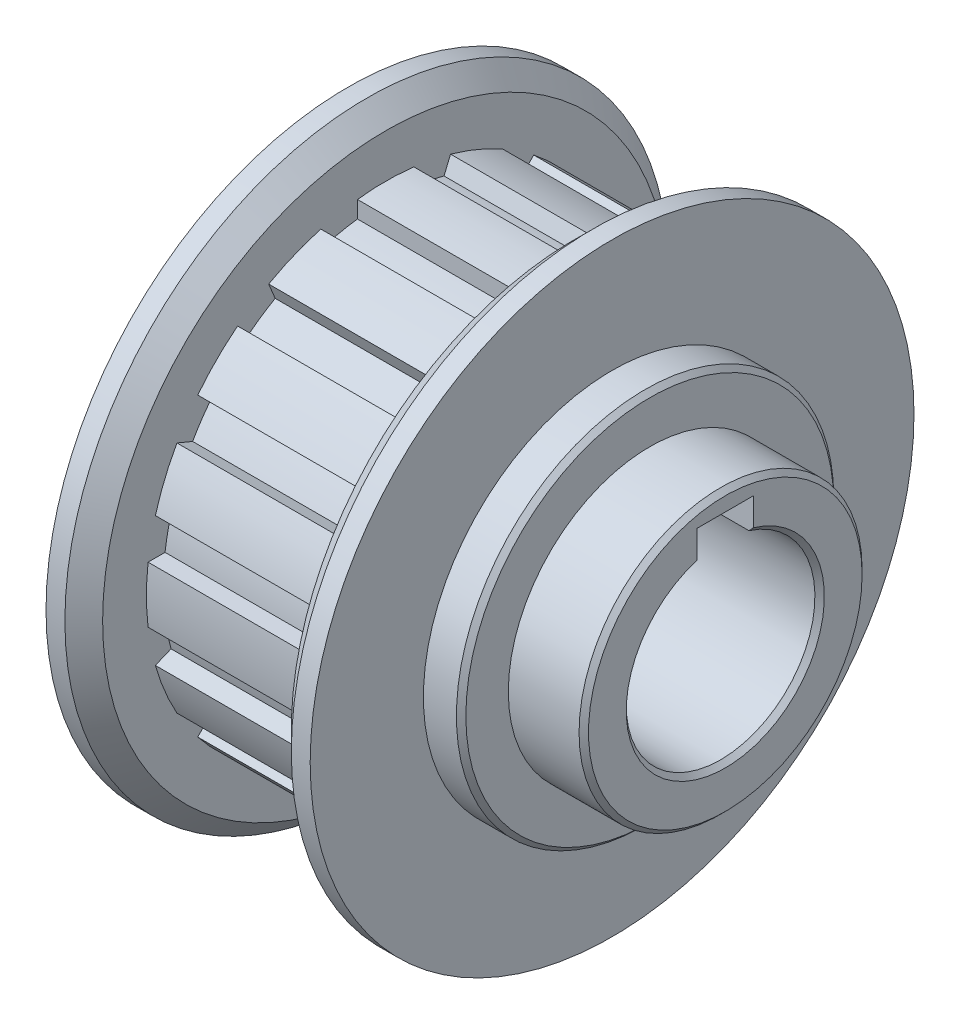
from build123d import *

# Parameters (mm, degrees)
BOSS_EXTRUDE1_START       = -13
BOSS_EXTRUDE1_DEPTH       = 14
BOSS_EXTRUDE1_START_2     = -25
BOSS_EXTRUDE1_2_OUTLINE_R = 9
BOSS_EXTRUDE1_2_DEPTH     = 12
BOSS_EXTRUDE1_START_3     = -1
BOSS_EXTRUDE1_3_OUTLINE_R = 16
BOSS_EXTRUDE1_3_DEPTH     = 2
BOSS_EXTRUDE1_4_OUTLINE_R = 14.25
BOSS_EXTRUDE1_4_DEPTH     = 0.9999999
SKETCH5_R                 = 16
BOSS_EXTRUDE3_DEPTH       = 2
SKETCH6_R                 = 10
BOSS_EXTRUDE4_DEPTH       = 12
CHAMFER1_SIZE             = 1
CUT_EXTRUDE1_START        = -10
SKETCH2_R                 = 10
SKETCH2_R_2               = 7.5
CUT_EXTRUDE1_DEPTH        = 10
CUT_EXTRUDE2_DEPTH        = 28.712812921
CUT_EXTRUDE2_DEPTH_BACK   = 28.712812921
SKETCH4_R                 = 5
CUT_EXTRUDE3_START        = -6
SKETCH7_R                 = 7.5
CUT_EXTRUDE3_DEPTH        = 6
CHAMFER2_SIZE             = 0.25
SKETCH8_W                 = 3
SKETCH8_H                 = 3
CUT_EXTRUDE4_DEPTH        = 31.199337741


with BuildPart() as part:
    # Boss-Extrude1: read off the stored shape, not the designer's step
    # Boss-Extrude1 outline → Boss-Extrude1 (new body)
    with BuildSketch(Plane.ZY.offset(BOSS_EXTRUDE1_START)):
        with BuildLine():
            ThreePointArc((-1.493827307, 11.692460658), (-2.299627171, 11.561006493), (-3.094394503, 11.374088047))
            Line((-3.094394503, 11.374088047), (-3.438518062, 12.20487581))
            ThreePointArc((-3.438518062, 12.20487581), (-4.852425922, 11.714792472), (-6.19875101, 11.061549888))
            Line((-6.19875101, 11.061549888), (-5.854627451, 10.230762125))
            ThreePointArc((-5.854627451, 10.230762125), (-6.548784122, 9.800948055), (-7.211522801, 9.324113638))
            Line((-7.211522801, 9.324113638), (-7.847380226, 9.959971063))
            ThreePointArc((-7.847380226, 9.959971063), (-8.966113985, 8.966113985), (-9.959971063, 7.847380226))
            Line((-9.959971063, 7.847380226), (-9.324113638, 7.211522801))
            ThreePointArc((-9.324113638, 7.211522801), (-9.800948055, 6.548784122), (-10.230762125, 5.854627451))
            Line((-10.230762125, 5.854627451), (-11.061549888, 6.19875101))
            ThreePointArc((-11.061549888, 6.19875101), (-11.714792472, 4.852425922), (-12.20487581, 3.438518062))
            Line((-12.20487581, 3.438518062), (-11.374088047, 3.094394503))
            ThreePointArc((-11.374088047, 3.094394503), (-11.561006493, 2.299627171), (-11.692460658, 1.493827307))
            Line((-11.692460658, 1.493827307), (-12.591698852, 1.493827307))
            ThreePointArc((-12.591698852, 1.493827307), (-12.68, 0), (-12.591698852, -1.493827307))
            Line((-12.591698852, -1.493827307), (-11.692460658, -1.493827307))
            ThreePointArc((-11.692460658, -1.493827307), (-11.561006493, -2.299627171), (-11.374088047, -3.094394503))
            Line((-11.374088047, -3.094394503), (-12.20487581, -3.438518062))
            ThreePointArc((-12.20487581, -3.438518062), (-11.714792472, -4.852425922), (-11.061549888, -6.19875101))
            Line((-11.061549888, -6.19875101), (-10.230762125, -5.854627451))
            ThreePointArc((-10.230762125, -5.854627451), (-9.800948055, -6.548784122), (-9.324113638, -7.211522801))
            Line((-9.324113638, -7.211522801), (-9.959971063, -7.847380226))
            ThreePointArc((-9.959971063, -7.847380226), (-8.966113985, -8.966113985), (-7.847380226, -9.959971063))
            Line((-7.847380226, -9.959971063), (-7.211522801, -9.324113638))
            ThreePointArc((-7.211522801, -9.324113638), (-6.548784122, -9.800948055), (-5.854627451, -10.230762125))
            Line((-5.854627451, -10.230762125), (-6.19875101, -11.061549888))
            ThreePointArc((-6.19875101, -11.061549888), (-4.852425922, -11.714792472), (-3.438518062, -12.20487581))
            Line((-3.438518062, -12.20487581), (-3.094394503, -11.374088047))
            ThreePointArc((-3.094394503, -11.374088047), (-2.299627171, -11.561006493), (-1.493827307, -11.692460658))
            Line((-1.493827307, -11.692460658), (-1.493827307, -12.591698852))
            ThreePointArc((-1.493827307, -12.591698852), (0, -12.68), (1.493827307, -12.591698852))
            Line((1.493827307, -12.591698852), (1.493827307, -11.692460658))
            ThreePointArc((1.493827307, -11.692460658), (2.299627171, -11.561006493), (3.094394503, -11.374088047))
            Line((3.094394503, -11.374088047), (3.438518062, -12.20487581))
            ThreePointArc((3.438518062, -12.20487581), (4.852425922, -11.714792472), (6.19875101, -11.061549888))
            Line((6.19875101, -11.061549888), (5.854627451, -10.230762125))
            ThreePointArc((5.854627451, -10.230762125), (6.548784122, -9.800948055), (7.211522801, -9.324113638))
            Line((7.211522801, -9.324113638), (7.847380226, -9.959971063))
            ThreePointArc((7.847380226, -9.959971063), (8.966113985, -8.966113985), (9.959971063, -7.847380226))
            Line((9.959971063, -7.847380226), (9.324113638, -7.211522801))
            ThreePointArc((9.324113638, -7.211522801), (9.800948055, -6.548784122), (10.230762125, -5.854627451))
            Line((10.230762125, -5.854627451), (11.061549888, -6.19875101))
            ThreePointArc((11.061549888, -6.19875101), (11.714792472, -4.852425922), (12.20487581, -3.438518062))
            Line((12.20487581, -3.438518062), (11.374088047, -3.094394503))
            ThreePointArc((11.374088047, -3.094394503), (11.561006493, -2.299627171), (11.692460658, -1.493827307))
            Line((11.692460658, -1.493827307), (12.591698852, -1.493827307))
            ThreePointArc((12.591698852, -1.493827307), (12.68, 0), (12.591698852, 1.493827307))
            Line((12.591698852, 1.493827307), (11.692460658, 1.493827307))
            ThreePointArc((11.692460658, 1.493827307), (11.561006493, 2.299627171), (11.374088047, 3.094394503))
            Line((11.374088047, 3.094394503), (12.20487581, 3.438518062))
            ThreePointArc((12.20487581, 3.438518062), (11.714792472, 4.852425922), (11.061549888, 6.19875101))
            Line((11.061549888, 6.19875101), (10.230762125, 5.854627451))
            ThreePointArc((10.230762125, 5.854627451), (9.800948055, 6.548784122), (9.324113638, 7.211522801))
            Line((9.324113638, 7.211522801), (9.959971063, 7.847380226))
            ThreePointArc((9.959971063, 7.847380226), (8.966113985, 8.966113985), (7.847380226, 9.959971063))
            Line((7.847380226, 9.959971063), (7.211522801, 9.324113638))
            ThreePointArc((7.211522801, 9.324113638), (6.548784122, 9.800948055), (5.854627451, 10.230762125))
            Line((5.854627451, 10.230762125), (6.19875101, 11.061549888))
            ThreePointArc((6.19875101, 11.061549888), (4.852425922, 11.714792472), (3.438518062, 12.20487581))
            Line((3.438518062, 12.20487581), (3.094394503, 11.374088047))
            ThreePointArc((3.094394503, 11.374088047), (2.299627171, 11.561006493), (1.493827307, 11.692460658))
            Line((1.493827307, 11.692460658), (1.493827307, 12.591698852))
            ThreePointArc((1.493827307, 12.591698852), (0, 12.68), (-1.493827307, 12.591698852))
            Line((-1.493827307, 12.591698852), (-1.493827307, 11.692460658))
        make_face()
    extrude(amount=BOSS_EXTRUDE1_DEPTH)

    # Boss-Extrude1 2 outline → Boss-Extrude1 2 (add)
    with BuildSketch(Plane.ZY.offset(BOSS_EXTRUDE1_START_2)):
        Circle(BOSS_EXTRUDE1_2_OUTLINE_R)
    extrude(amount=BOSS_EXTRUDE1_2_DEPTH)

    # Boss-Extrude1 3 outline → Boss-Extrude1 3 (add)
    with BuildSketch(Plane.ZY.offset(BOSS_EXTRUDE1_START_3)):
        Circle(BOSS_EXTRUDE1_3_OUTLINE_R)
        with BuildLine():
            Line((-3.438518062, 12.20487581), (-3.094394503, 11.374088047))
            ThreePointArc((-3.094394503, 11.374088047), (-2.299627171, 11.561006493), (-1.493827307, 11.692460658))
            Line((-1.493827307, 11.692460658), (-1.493827307, 12.591698852))
            ThreePointArc((-1.493827307, 12.591698852), (0, 12.68), (1.493827307, 12.591698852))
            Line((1.493827307, 12.591698852), (1.493827307, 11.692460658))
            ThreePointArc((1.493827307, 11.692460658), (2.299627171, 11.561006493), (3.094394503, 11.374088047))
            Line((3.094394503, 11.374088047), (3.438518062, 12.20487581))
            ThreePointArc((3.438518062, 12.20487581), (4.852425922, 11.714792472), (6.19875101, 11.061549888))
            Line((6.19875101, 11.061549888), (5.854627451, 10.230762125))
            ThreePointArc((5.854627451, 10.230762125), (6.548784122, 9.800948055), (7.211522801, 9.324113638))
            Line((7.211522801, 9.324113638), (7.847380226, 9.959971063))
            ThreePointArc((7.847380226, 9.959971063), (8.966113985, 8.966113985), (9.959971063, 7.847380226))
            Line((9.959971063, 7.847380226), (9.324113638, 7.211522801))
            ThreePointArc((9.324113638, 7.211522801), (9.800948055, 6.548784122), (10.230762125, 5.854627451))
            Line((10.230762125, 5.854627451), (11.061549888, 6.19875101))
            ThreePointArc((11.061549888, 6.19875101), (11.714792472, 4.852425922), (12.20487581, 3.438518062))
            Line((12.20487581, 3.438518062), (11.374088047, 3.094394503))
            ThreePointArc((11.374088047, 3.094394503), (11.561006493, 2.299627171), (11.692460658, 1.493827307))
            Line((11.692460658, 1.493827307), (12.591698852, 1.493827307))
            ThreePointArc((12.591698852, 1.493827307), (12.68, 0), (12.591698852, -1.493827307))
            Line((12.591698852, -1.493827307), (11.692460658, -1.493827307))
            ThreePointArc((11.692460658, -1.493827307), (11.561006493, -2.299627171), (11.374088047, -3.094394503))
            Line((11.374088047, -3.094394503), (12.20487581, -3.438518062))
            ThreePointArc((12.20487581, -3.438518062), (11.714792472, -4.852425922), (11.061549888, -6.19875101))
            Line((11.061549888, -6.19875101), (10.230762125, -5.854627451))
            ThreePointArc((10.230762125, -5.854627451), (9.800948055, -6.548784122), (9.324113638, -7.211522801))
            Line((9.324113638, -7.211522801), (9.959971063, -7.847380226))
            ThreePointArc((9.959971063, -7.847380226), (8.966113985, -8.966113985), (7.847380226, -9.959971063))
            Line((7.847380226, -9.959971063), (7.211522801, -9.324113638))
            ThreePointArc((7.211522801, -9.324113638), (6.548784122, -9.800948055), (5.854627451, -10.230762125))
            Line((5.854627451, -10.230762125), (6.19875101, -11.061549888))
            ThreePointArc((6.19875101, -11.061549888), (4.852425922, -11.714792472), (3.438518062, -12.20487581))
            Line((3.438518062, -12.20487581), (3.094394503, -11.374088047))
            ThreePointArc((3.094394503, -11.374088047), (2.299627171, -11.561006493), (1.493827307, -11.692460658))
            Line((1.493827307, -11.692460658), (1.493827307, -12.591698852))
            ThreePointArc((1.493827307, -12.591698852), (0, -12.68), (-1.493827307, -12.591698852))
            Line((-1.493827307, -12.591698852), (-1.493827307, -11.692460658))
            ThreePointArc((-1.493827307, -11.692460658), (-2.299627171, -11.561006493), (-3.094394503, -11.374088047))
            Line((-3.094394503, -11.374088047), (-3.438518062, -12.20487581))
            ThreePointArc((-3.438518062, -12.20487581), (-4.852425922, -11.714792472), (-6.19875101, -11.061549888))
            Line((-6.19875101, -11.061549888), (-5.854627451, -10.230762125))
            ThreePointArc((-5.854627451, -10.230762125), (-6.548784122, -9.800948055), (-7.211522801, -9.324113638))
            Line((-7.211522801, -9.324113638), (-7.847380226, -9.959971063))
            ThreePointArc((-7.847380226, -9.959971063), (-8.966113985, -8.966113985), (-9.959971063, -7.847380226))
            Line((-9.959971063, -7.847380226), (-9.324113638, -7.211522801))
            ThreePointArc((-9.324113638, -7.211522801), (-9.800948055, -6.548784122), (-10.230762125, -5.854627451))
            Line((-10.230762125, -5.854627451), (-11.061549888, -6.19875101))
            ThreePointArc((-11.061549888, -6.19875101), (-11.714792472, -4.852425922), (-12.20487581, -3.438518062))
            Line((-12.20487581, -3.438518062), (-11.374088047, -3.094394503))
            ThreePointArc((-11.374088047, -3.094394503), (-11.561006493, -2.299627171), (-11.692460658, -1.493827307))
            Line((-11.692460658, -1.493827307), (-12.591698852, -1.493827307))
            ThreePointArc((-12.591698852, -1.493827307), (-12.68, 0), (-12.591698852, 1.493827307))
            Line((-12.591698852, 1.493827307), (-11.692460658, 1.493827307))
            ThreePointArc((-11.692460658, 1.493827307), (-11.561006493, 2.299627171), (-11.374088047, 3.094394503))
            Line((-11.374088047, 3.094394503), (-12.20487581, 3.438518062))
            ThreePointArc((-12.20487581, 3.438518062), (-11.714792472, 4.852425922), (-11.061549888, 6.19875101))
            Line((-11.061549888, 6.19875101), (-10.230762125, 5.854627451))
            ThreePointArc((-10.230762125, 5.854627451), (-9.800948055, 6.548784122), (-9.324113638, 7.211522801))
            Line((-9.324113638, 7.211522801), (-9.959971063, 7.847380226))
            ThreePointArc((-9.959971063, 7.847380226), (-8.966113985, 8.966113985), (-7.847380226, 9.959971063))
            Line((-7.847380226, 9.959971063), (-7.211522801, 9.324113638))
            ThreePointArc((-7.211522801, 9.324113638), (-6.548784122, 9.800948055), (-5.854627451, 10.230762125))
            Line((-5.854627451, 10.230762125), (-6.19875101, 11.061549888))
            ThreePointArc((-6.19875101, 11.061549888), (-4.852425922, 11.714792472), (-3.438518062, 12.20487581))
        make_face(mode=Mode.SUBTRACT)
    extrude(amount=BOSS_EXTRUDE1_3_DEPTH)

    # Boss-Extrude1 4 outline → Boss-Extrude1 4 (add)
    with BuildSketch(Plane.ZY.offset(BOSS_EXTRUDE1_START)):
        Circle(BOSS_EXTRUDE1_4_OUTLINE_R)
        with BuildLine():
            Line((-3.438518062, 12.20487581), (-3.094394503, 11.374088047))
            ThreePointArc((-3.094394503, 11.374088047), (-2.299627171, 11.561006493), (-1.493827307, 11.692460658))
            Line((-1.493827307, 11.692460658), (-1.493827307, 12.591698852))
            ThreePointArc((-1.493827307, 12.591698852), (0, 12.68), (1.493827307, 12.591698852))
            Line((1.493827307, 12.591698852), (1.493827307, 11.692460658))
            ThreePointArc((1.493827307, 11.692460658), (2.299627171, 11.561006493), (3.094394503, 11.374088047))
            Line((3.094394503, 11.374088047), (3.438518062, 12.20487581))
            ThreePointArc((3.438518062, 12.20487581), (4.852425922, 11.714792472), (6.19875101, 11.061549888))
            Line((6.19875101, 11.061549888), (5.854627451, 10.230762125))
            ThreePointArc((5.854627451, 10.230762125), (6.548784122, 9.800948055), (7.211522801, 9.324113638))
            Line((7.211522801, 9.324113638), (7.847380226, 9.959971063))
            ThreePointArc((7.847380226, 9.959971063), (8.966113985, 8.966113985), (9.959971063, 7.847380226))
            Line((9.959971063, 7.847380226), (9.324113638, 7.211522801))
            ThreePointArc((9.324113638, 7.211522801), (9.800948055, 6.548784122), (10.230762125, 5.854627451))
            Line((10.230762125, 5.854627451), (11.061549888, 6.19875101))
            ThreePointArc((11.061549888, 6.19875101), (11.714792472, 4.852425922), (12.20487581, 3.438518062))
            Line((12.20487581, 3.438518062), (11.374088047, 3.094394503))
            ThreePointArc((11.374088047, 3.094394503), (11.561006493, 2.299627171), (11.692460658, 1.493827307))
            Line((11.692460658, 1.493827307), (12.591698852, 1.493827307))
            ThreePointArc((12.591698852, 1.493827307), (12.68, 0), (12.591698852, -1.493827307))
            Line((12.591698852, -1.493827307), (11.692460658, -1.493827307))
            ThreePointArc((11.692460658, -1.493827307), (11.561006493, -2.299627171), (11.374088047, -3.094394503))
            Line((11.374088047, -3.094394503), (12.20487581, -3.438518062))
            ThreePointArc((12.20487581, -3.438518062), (11.714792472, -4.852425922), (11.061549888, -6.19875101))
            Line((11.061549888, -6.19875101), (10.230762125, -5.854627451))
            ThreePointArc((10.230762125, -5.854627451), (9.800948055, -6.548784122), (9.324113638, -7.211522801))
            Line((9.324113638, -7.211522801), (9.959971063, -7.847380226))
            ThreePointArc((9.959971063, -7.847380226), (8.966113985, -8.966113985), (7.847380226, -9.959971063))
            Line((7.847380226, -9.959971063), (7.211522801, -9.324113638))
            ThreePointArc((7.211522801, -9.324113638), (6.548784122, -9.800948055), (5.854627451, -10.230762125))
            Line((5.854627451, -10.230762125), (6.19875101, -11.061549888))
            ThreePointArc((6.19875101, -11.061549888), (4.852425922, -11.714792472), (3.438518062, -12.20487581))
            Line((3.438518062, -12.20487581), (3.094394503, -11.374088047))
            ThreePointArc((3.094394503, -11.374088047), (2.299627171, -11.561006493), (1.493827307, -11.692460658))
            Line((1.493827307, -11.692460658), (1.493827307, -12.591698852))
            ThreePointArc((1.493827307, -12.591698852), (0, -12.68), (-1.493827307, -12.591698852))
            Line((-1.493827307, -12.591698852), (-1.493827307, -11.692460658))
            ThreePointArc((-1.493827307, -11.692460658), (-2.299627171, -11.561006493), (-3.094394503, -11.374088047))
            Line((-3.094394503, -11.374088047), (-3.438518062, -12.20487581))
            ThreePointArc((-3.438518062, -12.20487581), (-4.852425922, -11.714792472), (-6.19875101, -11.061549888))
            Line((-6.19875101, -11.061549888), (-5.854627451, -10.230762125))
            ThreePointArc((-5.854627451, -10.230762125), (-6.548784122, -9.800948055), (-7.211522801, -9.324113638))
            Line((-7.211522801, -9.324113638), (-7.847380226, -9.959971063))
            ThreePointArc((-7.847380226, -9.959971063), (-8.966113985, -8.966113985), (-9.959971063, -7.847380226))
            Line((-9.959971063, -7.847380226), (-9.324113638, -7.211522801))
            ThreePointArc((-9.324113638, -7.211522801), (-9.800948055, -6.548784122), (-10.230762125, -5.854627451))
            Line((-10.230762125, -5.854627451), (-11.061549888, -6.19875101))
            ThreePointArc((-11.061549888, -6.19875101), (-11.714792472, -4.852425922), (-12.20487581, -3.438518062))
            Line((-12.20487581, -3.438518062), (-11.374088047, -3.094394503))
            ThreePointArc((-11.374088047, -3.094394503), (-11.561006493, -2.299627171), (-11.692460658, -1.493827307))
            Line((-11.692460658, -1.493827307), (-12.591698852, -1.493827307))
            ThreePointArc((-12.591698852, -1.493827307), (-12.68, 0), (-12.591698852, 1.493827307))
            Line((-12.591698852, 1.493827307), (-11.692460658, 1.493827307))
            ThreePointArc((-11.692460658, 1.493827307), (-11.561006493, 2.299627171), (-11.374088047, 3.094394503))
            Line((-11.374088047, 3.094394503), (-12.20487581, 3.438518062))
            ThreePointArc((-12.20487581, 3.438518062), (-11.714792472, 4.852425922), (-11.061549888, 6.19875101))
            Line((-11.061549888, 6.19875101), (-10.230762125, 5.854627451))
            ThreePointArc((-10.230762125, 5.854627451), (-9.800948055, 6.548784122), (-9.324113638, 7.211522801))
            Line((-9.324113638, 7.211522801), (-9.959971063, 7.847380226))
            ThreePointArc((-9.959971063, 7.847380226), (-8.966113985, 8.966113985), (-7.847380226, 9.959971063))
            Line((-7.847380226, 9.959971063), (-7.211522801, 9.324113638))
            ThreePointArc((-7.211522801, 9.324113638), (-6.548784122, 9.800948055), (-5.854627451, 10.230762125))
            Line((-5.854627451, 10.230762125), (-6.19875101, 11.061549888))
            ThreePointArc((-6.19875101, 11.061549888), (-4.852425922, 11.714792472), (-3.438518062, 12.20487581))
        make_face(mode=Mode.SUBTRACT)
    extrude(amount=BOSS_EXTRUDE1_4_DEPTH)

    # Boss-Extrude1 5 outline → Boss-Extrude1 5 (revolve)
    with BuildSketch(Plane.YX):
        Polygon((11.7875, 12.0000001), (11.7875, 11), (13.25, 11), (14.25, 12), align=None)
    revolve(axis=Axis((0, 0, 0), (1, 0, 0)))

    # Sketch5 → Boss-Extrude3 (add)
    with BuildSketch(Plane(origin=(13, 0, 0), x_dir=(0, 0, -1), z_dir=(1, 0, 0))):
        with Locations(Location((0, 0, 0), (0, 0, 180))):
            Circle(SKETCH5_R)
    extrude(amount=-BOSS_EXTRUDE3_DEPTH)

    # Sketch6 → Boss-Extrude4 (add)
    with BuildSketch(Plane(origin=(13, 0, 0), x_dir=(0, 0, -1), z_dir=(1, 0, 0))):
        Circle(SKETCH6_R)
    extrude(amount=BOSS_EXTRUDE4_DEPTH)

    # Chamfer1
    chamfer1_edges = [part.edges().sort_by_distance(p)[0] for p in [
        (1, 0, -16),
        (11, 0, -16),
    ]]
    chamfer(chamfer1_edges, length=CHAMFER1_SIZE)

    # Sketch2 → Cut-Extrude1 (cut)
    with BuildSketch(Plane(origin=(25, 0, 0), x_dir=(0, 0, -1), z_dir=(1, 0, 0)).offset(CUT_EXTRUDE1_START)):
        Circle(SKETCH2_R)
        Circle(SKETCH2_R_2, mode=Mode.SUBTRACT)
    extrude(amount=CUT_EXTRUDE1_DEPTH, mode=Mode.SUBTRACT)

    # Sketch4 → Cut-Extrude2 (cut, two sides: drawn at the far end of the back side and taken through both)
    with BuildSketch(Plane(origin=(15, 0, 0), x_dir=(0, 0, -1), z_dir=(1, 0, 0)).offset(-CUT_EXTRUDE2_DEPTH_BACK)):
        Circle(SKETCH4_R)
    extrude(amount=CUT_EXTRUDE2_DEPTH + CUT_EXTRUDE2_DEPTH_BACK, mode=Mode.SUBTRACT)

    # Sketch7 → Cut-Extrude3 (cut)
    with BuildSketch(Plane(origin=(25, 0, 0), x_dir=(0, 0, -1), z_dir=(1, 0, 0)).offset(CUT_EXTRUDE3_START)):
        Circle(SKETCH7_R)
    extrude(amount=CUT_EXTRUDE3_DEPTH, mode=Mode.SUBTRACT)

    # Chamfer2
    chamfer2_edges = [part.edges().sort_by_distance(p)[0] for p in [
        (15, 0, 10),
        (-1, 0, 5),
        (19, 0, 7.5),
        (19, 0, 5),
    ]]
    chamfer(chamfer2_edges, length=CHAMFER2_SIZE)

    # Sketch8 → Cut-Extrude4 (cut, through all)
    with BuildSketch(Plane(origin=(19, 0, 0), x_dir=(0, 0, -1), z_dir=(1, 0, 0))):
        with Locations((0, 5)):
            Rectangle(SKETCH8_W, SKETCH8_H)
    extrude(amount=-CUT_EXTRUDE4_DEPTH, mode=Mode.SUBTRACT)


solid = part.part
